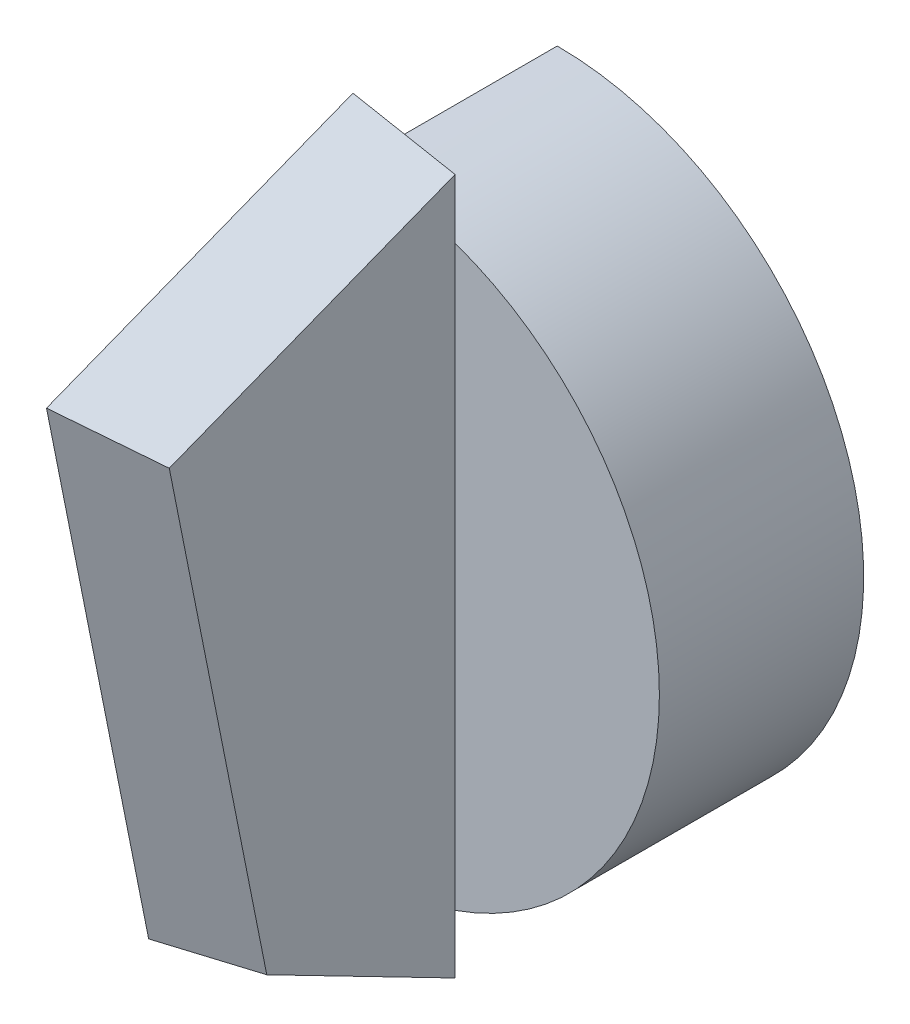
from build123d import *

# Parameters (mm, degrees)
BOSS_EXTRUDE1_DEPTH = 10
BOSS_EXTRUDE2_DEPTH = 5
DRAFT1_ANGLE        = 10


with BuildPart() as part:
    # Sketch1 → Boss-Extrude1 (new body)
    with BuildSketch(Plane.XY):
        with BuildLine():
            Line((0, 15), (0, -15))
            ThreePointArc((0, -15), (15, 0), (0, 15))
        make_face()
    extrude(amount=BOSS_EXTRUDE1_DEPTH)

    # Sketch3 → Boss-Extrude2 (add)
    with BuildSketch(Plane(origin=(0, 0, 0), x_dir=(0, 0, -1), z_dir=(1, 0, 0))):
        Polygon((-10, 18), (-10, -18), (-20, -12.85125141), (-25, 12.14874859), align=None)
    extrude(amount=BOSS_EXTRUDE2_DEPTH)

    # Draft1
    draft1_faces = [part.faces().sort_by_distance(p)[0] for p in [
        (2.5, 15.074374295, 17.5),
        (2.5, -0.35125141, 22.5),
        (2.5, -15.425625705, 15),
    ]]
    draft(draft1_faces, Plane(origin=(0, 0, 0), x_dir=(0, 0, 1), z_dir=(1, 0, 0)), DRAFT1_ANGLE)


solid = part.part
